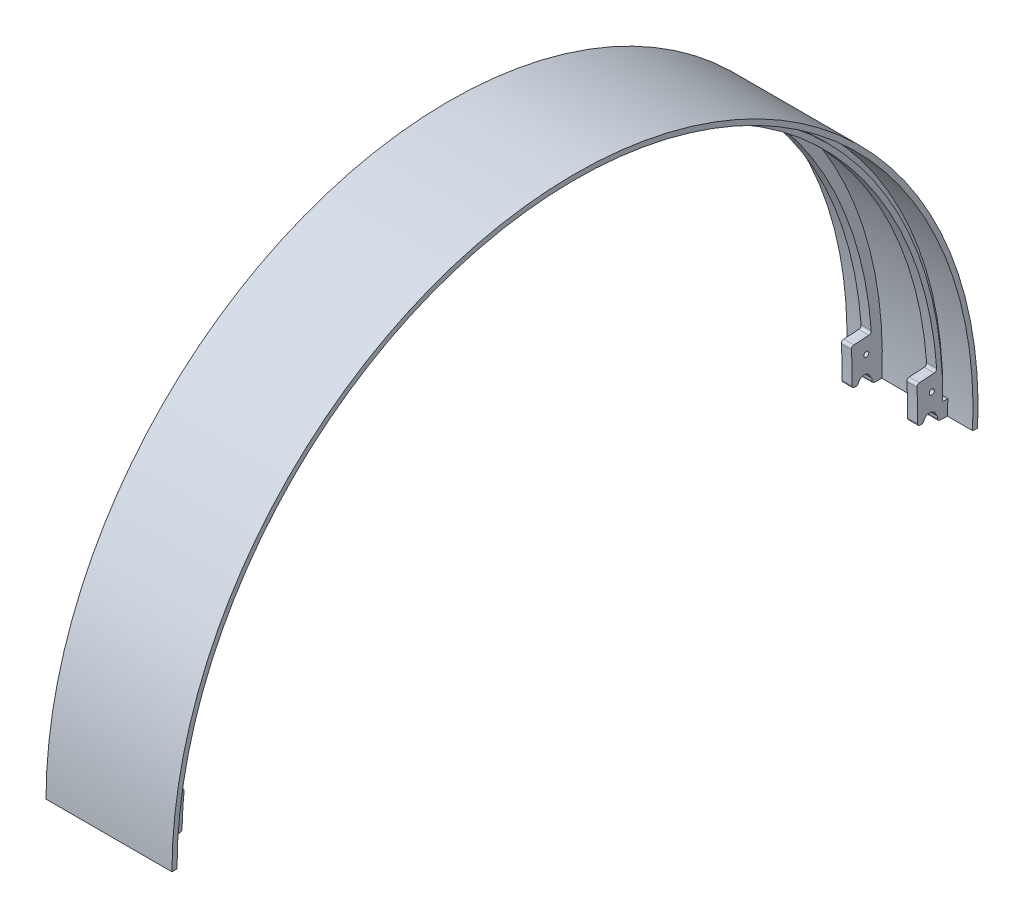
from build123d import *

# Parameters (mm, degrees)
CROQUIS2_W                 = 2
CROQUIS2_H                 = 6
REVOLUCI_N1_ANGLE          = 182.6302972
CORTAR_EXTRUIR2_DEPTH      = 101
CORTAR_EXTRUIR2_DEPTH_BACK = 64
CROQUIS3_R                 = 0.5
REDONDEO1_R                = 0.5
REDONDEO2_R                = 0.5
CORTAR_EXTRUIR4_START      = -1
CROQUIS5_R                 = 79
CROQUIS5_R_2               = 78
CORTAR_EXTRUIR4_DEPTH      = 1
CROQUIS6_R                 = 79
CROQUIS6_R_2               = 78
CORTAR_EXTRUIR5_DEPTH      = 1
CROQUIS7_W                 = 1
CROQUIS7_H                 = 1
REVOLUCI_N2_ANGLE          = 2.14859164
CROQUIS8_W                 = 1
CROQUIS8_H                 = 1
REVOLUCI_N4_ANGLE          = 2.15


with BuildPart() as part:
    # Croquis2 → Revolución1 (revolve)
    with BuildSketch(Plane(origin=(0, 0, 0), x_dir=(1, 0, 0), z_dir=(0, 1, 0))):
        Polygon((-9.632985998, 12.997479648), (-9.632985998, 11.997479648), (2.867014002, 11.997479648), (2.867014002, 12.997479648), (-2.132985998, 12.997479648), (-4.132985998, 12.997479648), align=None)
        Polygon((-22.132985998, 12.997479648), (-22.132985998, 11.997479648), (-9.632985998, 11.997479648), (-9.632985998, 12.997479648), (-15.132985998, 12.997479648), (-17.132985998, 12.997479648), align=None)
        with Locations((-16.132985998, 15.997479648)):
            Rectangle(CROQUIS2_W, CROQUIS2_H)
        with Locations((-3.132985998, 15.997479648)):
            Rectangle(CROQUIS2_W, CROQUIS2_H)
    revolve(axis=Axis((-9.632985998, 0, -91.997479648), (-1, 0, 0)), revolution_arc=REVOLUCI_N1_ANGLE)

    # Croquis3 → Cortar-Extruir2 (cut, two sides: drawn at the far end of the back side and taken through both)
    with BuildSketch(Plane(origin=(-2.132985998, 0, 0), x_dir=(0, 0, -1), z_dir=(1, 0, 0)).offset(-CORTAR_EXTRUIR2_DEPTH_BACK)):
        with BuildLine():
            ThreePointArc((168.916355745, -3.533624195), (168.93693777, -3.052832115), (168.954514567, -2.571920792))
            Line((168.954514567, -2.571920792), (168.667238596, -2.562319967))
            ThreePointArc((168.667238596, -2.562319967), (167.459688042, -1.271265491), (166.168633566, -2.478816045))
            Line((166.168633566, -2.478816045), (164.956746519, -2.438314517))
            ThreePointArc((164.956746519, -2.438314517), (164.940082803, -2.894243433), (164.920569974, -3.350059302))
            Line((164.920569974, -3.350059302), (168.916355745, -3.533624195))
        make_face()
        with BuildLine():
            ThreePointArc((15.003504022, 0.963180773), (14.998985756, 0.481599807), (14.997479648, 0))
            Line((14.997479648, 0), (18.997479648, 0))
            ThreePointArc((18.997479648, 0), (18.998907517, 0.456581635), (19.003191067, 0.913145409))
            Line((19.003191067, 0.913145409), (17.761151954, 0.928683094))
            ThreePointArc((17.761151954, 0.928683094), (16.526885803, 2.194221348), (15.26134755, 0.959955197))
            Line((15.26134755, 0.959955197), (15.003504022, 0.963180773))
        make_face()
        with Locations(Location((167.817479648, 2.060185692, 0), (0, 0, 180))):
            Circle(CROQUIS3_R)
        with Locations(Location((16.440869241, 5.536404348, 0), (0, 0, 180))):
            Circle(CROQUIS3_R)
        with BuildLine():
            ThreePointArc((168.826809108, 5.123878873), (93.764723702, 76.979717124), (15.484227806, 8.644205721))
            Line((15.484227806, 8.644205721), (19.458942188, 8.195156073))
            ThreePointArc((19.458942188, 8.195156073), (93.672918816, 72.98077078), (164.835675111, 4.857703347))
            Line((164.835675111, 4.857703347), (168.826809108, 5.123878873))
        make_face()
    extrude(amount=CORTAR_EXTRUIR2_DEPTH + CORTAR_EXTRUIR2_DEPTH_BACK, mode=Mode.SUBTRACT)

    # Redondeo1
    # the kernel refuses this fillet: 0.5 mm, written as the material it adds along each edge
    with BuildSketch(Plane(origin=(-17.132985998, 5.123878873, -168.826809108), x_dir=(0, -0.06654388147144101, 0.9977834994820844), z_dir=(1, 0, 0)), Plane(origin=(-4.132985998, 5.123878873, -168.826809108), x_dir=(0, -0.06654388147144101, 0.9977834994820844), z_dir=(1, 0, 0))) as redondeo1_piece_1:
        with BuildLine():
            CenterArc((0.501634004, -0.5), REDONDEO1_R, 90, 90.374484885)
            ThreePointArc((0.001644684, -0.503267974), (0.000411172, -0.251635331), (0, 0))
            Line((0, 0), (0.501634004, 0))
        make_face()
    extrude(amount=2)
    # the kernel refuses this fillet: 0.5 mm, written as the material it takes off along each edge
    with BuildSketch(Plane(origin=(-18.378734248, 4.857703347, -164.835675111), x_dir=(0, -0.9980040686356455, -0.06314965547568487), z_dir=(1, 0, 0)), Plane(origin=(-5.378734248, 4.857703347, -164.835675111), x_dir=(0, -0.9980040686356455, -0.06314965547568487), z_dir=(1, 0, 0))) as redondeo1_2_piece_1:
        with BuildLine():
            CenterArc((0.498302202, 0.499997108), REDONDEO1_R, 180.194885107, 89.610229786)
            Line((-0.001694905, 0.498296418), (0, 0))
            ThreePointArc((0, 0), (0.248300756, 0.000422284), (0.496601512, 0))
        make_face()
    extrude(amount=4.4914965, mode=Mode.SUBTRACT)
    with BuildSketch(Plane(origin=(-5.378953698, -3.533624195, -168.916355745), x_dir=(0, -0.045891223305881, -0.9989464428203795), z_dir=(1, 0, 0)), Plane(origin=(-18.378953698, -3.533624195, -168.916355745), x_dir=(0, -0.045891223305881, -0.9989464428203795), z_dir=(1, 0, 0))) as redondeo1_2_piece_2:
        with BuildLine():
            CenterArc((0.49838708, 0.5), REDONDEO1_R, 180.369652755, 89.630347245)
            ThreePointArc((-0.001602514, 0.496774194), (-0.00040063, 0.248388389), (0, 0))
            Line((0, 0), (0.49838708, 0))
        make_face()
    extrude(amount=4.4919354, mode=Mode.SUBTRACT)
    with BuildSketch(Plane(origin=(-14.06535854, -2.478816045, -166.168633566), x_dir=(0, 0.9841495238599837, -0.17734067408851076), z_dir=(-1, 0, 0)), Plane(origin=(-1.06535854, -2.478816045, -166.168633566), x_dir=(0, 0.9841495238599838, -0.17734067408851054), z_dir=(-1, 0, 0))) as redondeo1_2_piece_3:
        with BuildLine():
            CenterArc((0.433108746, -0.494761918), REDONDEO1_R, 98.3007748, 73.398450401)
            Line((-0.061653172, -0.422577127), (0, 0))
            ThreePointArc((0, 0), (0.180461978, -0.013095204), (0.360923955, 0))
        make_face()
    extrude(amount=4.135254916, mode=Mode.SUBTRACT)
    with BuildSketch(Plane(origin=(-17.995200064, -2.562319967, -168.667238596), x_dir=(0, -0.033401568724359246, -0.9994420119280317), z_dir=(1, 0, 0)), Plane(origin=(-4.995200064, -2.562319967, -168.667238596), x_dir=(0, -0.033401568724359246, -0.9994420119280317), z_dir=(1, 0, 0))) as redondeo1_2_piece_4:
        with BuildLine():
            CenterArc((0.433390187, 0.478223253), REDONDEO1_R, 195.858969576, 57.168831014)
            ThreePointArc((-0.047578438, 0.341588038), (-0.011951747, 0.172442813), (0, 0))
            Line((0, 0), (0.287436357, 0))
        make_face()
    extrude(amount=3.724428132, mode=Mode.SUBTRACT)
    with BuildSketch(Plane(origin=(-13.887237748, -2.438314517, -164.956746519), x_dir=(0, -0.03340156872588579, -0.9994420119279808), z_dir=(-1, 0, 0)), Plane(origin=(-0.887237748, -2.438314517, -164.956746519), x_dir=(0, -0.03340156872588579, -0.9994420119279808), z_dir=(-1, 0, 0))) as redondeo1_2_piece_5:
        with BuildLine():
            CenterArc((0.4982993, -0.5), REDONDEO1_R, 90, 89.610229786)
            ThreePointArc((-0.001689131, -0.496598639), (-0.000422284, -0.248300756), (0, 0))
            Line((0, 0), (0.4982993, 0))
        make_face()
    extrude(amount=4.4914965, mode=Mode.SUBTRACT)

    # Redondeo2
    # the kernel refuses this fillet: 0.5 mm, written as the material it adds along each edge
    with BuildSketch(Plane(origin=(-15.132985998, 8.644205721, -15.484227806), x_dir=(0, 0.9933064166232053, -0.11550914550444648), z_dir=(-1, 0, 0)), Plane(origin=(-2.132985998, 8.644205721, -15.484227806), x_dir=(0, 0.9933064166232053, -0.11550914550444648), z_dir=(-1, 0, 0))) as redondeo2_piece_1:
        with BuildLine():
            CenterArc((0.501636666, 0.49999733), REDONDEO2_R, 179.812757557, 90.374484885)
            Line((0.001639336, 0.501631326), (0, 0))
            ThreePointArc((0, 0), (0.251635331, -0.000411172), (0.503270661, 0))
        make_face()
    extrude(amount=2)
    # the kernel refuses this fillet: 0.5 mm, written as the material it takes off along each edge
    with BuildSketch(Plane(origin=(-5.378953698, 0, -14.997479648), x_dir=(0, 0, 1), z_dir=(1, 0, 0)), Plane(origin=(-18.378953698, 0, -14.997479648), x_dir=(0, 0, 1), z_dir=(1, 0, 0))) as redondeo2_2_piece_1:
        with BuildLine():
            CenterArc((0.49838708, -0.5), REDONDEO2_R, 90, 89.630347245)
            ThreePointArc((-0.001602514, -0.496774194), (-0.00040063, -0.248388389), (0, 0))
            Line((0, 0), (0.49838708, 0))
        make_face()
    extrude(amount=4.4919354, mode=Mode.SUBTRACT)
    with BuildSketch(Plane(origin=(-14.291422485, 0.959955197, -15.26134755), x_dir=(0, 0.0125088412135749, 0.9999217613851065), z_dir=(-1, 0, 0))) as redondeo2_2_piece_2:
        with BuildLine():
            CenterArc((0.436542668, 0.466983755), REDONDEO2_R, 195.476781903, 53.585192252)
            ThreePointArc((-0.045326665, 0.333559825), (-0.0113835, 0.168312703), (0, 0))
            Line((0, 0), (0.257863703, 0))
        make_face()
    extrude(amount=3.683127026, mode=Mode.SUBTRACT)
    with BuildSketch(Plane(origin=(-14.06535854, 0.928683094, -17.761151954), x_dir=(0, 0.9912523140828179, 0.13198049032133008), z_dir=(-1, 0, 0))) as redondeo2_2_piece_3:
        with BuildLine():
            CenterArc((0.433108746, 0.494761918), REDONDEO2_R, 188.300774799, 73.398450401)
            Line((-0.061653172, 0.422577127), (0, 0))
            ThreePointArc((0, 0), (0.180461978, 0.013095204), (0.360923955, 0))
        make_face()
    extrude(amount=4.135254916, mode=Mode.SUBTRACT)
    with BuildSketch(Plane(origin=(-13.887237748, 0.913145409, -19.003191067), x_dir=(0, 0.012508841212886753, 0.9999217613851149), z_dir=(-1, 0, 0))) as redondeo2_2_piece_4:
        with BuildLine():
            CenterArc((0.4982993, 0.5), REDONDEO2_R, 180.389770214, 89.610229786)
            ThreePointArc((-0.001689131, 0.496598639), (-0.000422284, 0.248300756), (0, 0))
            Line((0, 0), (0.4982993, 0))
        make_face()
    extrude(amount=4.4914965, mode=Mode.SUBTRACT)
    with BuildSketch(Plane(origin=(-1.291422485, 0.959955197, -15.26134755), x_dir=(0, 0.9891313564110952, -0.1470345529606798), z_dir=(-1, 0, 0))) as redondeo2_2_piece_5:
        with BuildLine():
            CenterArc((0.403950486, -0.4954466), REDONDEO2_R, 97.738390952, 53.585192252)
            Line((-0.034721389, -0.25551539), (0, 0))
            ThreePointArc((0, 0), (0.168312703, -0.0113835), (0.336625405, 0))
        make_face()
    extrude(amount=3.683127026, mode=Mode.SUBTRACT)
    with BuildSketch(Plane(origin=(-1.06535854, 0.928683094, -17.761151954), x_dir=(0, -0.012508841213102863, -0.9999217613851122), z_dir=(-1, 0, 0))) as redondeo2_2_piece_6:
        with BuildLine():
            CenterArc((0.427050983, -0.5), REDONDEO2_R, 90, 73.398450401)
            ThreePointArc((-0.052106441, -0.357142857), (-0.013095204, -0.180461978), (0, 0))
            Line((0, 0), (0.427050983, 0))
        make_face()
    extrude(amount=4.135254916, mode=Mode.SUBTRACT)
    with BuildSketch(Plane(origin=(-0.887237748, 0.913145409, -19.003191067), x_dir=(0, 0.9998734298021862, -0.015909882954082417), z_dir=(-1, 0, 0))) as redondeo2_2_piece_7:
        with BuildLine():
            CenterArc((0.498302202, -0.499997108), REDONDEO2_R, 90.194885107, 89.610229786)
            Line((-0.001694905, -0.498296418), (0, 0))
            ThreePointArc((0, 0), (0.248300756, -0.000422284), (0.496601512, 0))
        make_face()
    extrude(amount=4.4914965, mode=Mode.SUBTRACT)
    with BuildSketch(Plane(origin=(-13.887237748, 8.195156073, -19.458942188), x_dir=(0, -0.9940546943563762, 0.10888188383772368), z_dir=(-1, 0, 0))) as redondeo2_2_piece_8:
        with BuildLine():
            CenterArc((0.498302202, 0.499997108), REDONDEO2_R, 180.194885107, 89.610229786)
            Line((-0.001694905, 0.498296418), (0, 0))
            ThreePointArc((0, 0), (0.248300756, 0.000422284), (0.496601512, 0))
        make_face()
    extrude(amount=4.4914965, mode=Mode.SUBTRACT)
    with BuildSketch(Plane(origin=(-0.887237748, 8.195156073, -19.458942188), x_dir=(0, 0.11226241196204409, 0.9936785953518695), z_dir=(-1, 0, 0))) as redondeo2_2_piece_9:
        with BuildLine():
            CenterArc((0.4982993, -0.5), REDONDEO2_R, 90, 89.610229786)
            ThreePointArc((-0.001689131, -0.496598639), (-0.000422284, -0.248300756), (0, 0))
            Line((0, 0), (0.4982993, 0))
        make_face()
    extrude(amount=4.4914965, mode=Mode.SUBTRACT)

    # Croquis5 → Cortar-Extruir4 (cut)
    with BuildSketch(Plane(origin=(-2.132985998, 0, 0), x_dir=(0, 0, -1), z_dir=(1, 0, 0)).offset(CORTAR_EXTRUIR4_START)):
        with Locations((91.997479648, 0)):
            Circle(CROQUIS5_R)
        with Locations((91.997479648, 0)):
            Circle(CROQUIS5_R_2, mode=Mode.SUBTRACT)
    extrude(amount=CORTAR_EXTRUIR4_DEPTH, mode=Mode.SUBTRACT)

    # Croquis6 → Cortar-Extruir5 (cut)
    with BuildSketch(Plane.ZY.offset(17.132985998)):
        with Locations((-91.997479648, 0)):
            Circle(CROQUIS6_R)
        with Locations((-91.997479648, 0)):
            Circle(CROQUIS6_R_2, mode=Mode.SUBTRACT)
    extrude(amount=-CORTAR_EXTRUIR5_DEPTH, mode=Mode.SUBTRACT)

    # Croquis7 → Revolución2 (revolve)
    with BuildSketch(Plane.XZ):
        with Locations((-16.632985998, -13.497479648)):
            Rectangle(CROQUIS7_W, CROQUIS7_H)
        with Locations((-2.632985998, -13.497479648)):
            Rectangle(CROQUIS7_W, CROQUIS7_H)
    revolve(axis=Axis((-9.632985998, 0, -91.997479648), (-1, 0, 0)), revolution_arc=REVOLUCI_N2_ANGLE)

    # Croquis8 → Revolución4 (revolve)
    with BuildSketch(Plane(origin=(0, 4.217428894, -0.193747095), x_dir=(1, 0, 0), z_dir=(0, -0.9989464428202578, 0.04589122330853027))):
        with Locations((-16.632985998, -170.400555043)):
            Rectangle(CROQUIS8_W, CROQUIS8_H)
        with Locations((-2.632985998, -170.400555043)):
            Rectangle(CROQUIS8_W, CROQUIS8_H)
    revolve(axis=Axis((-9.632985998, 0, -91.997479648), (1, 0, 0)), revolution_arc=REVOLUCI_N4_ANGLE)


solid = part.part
